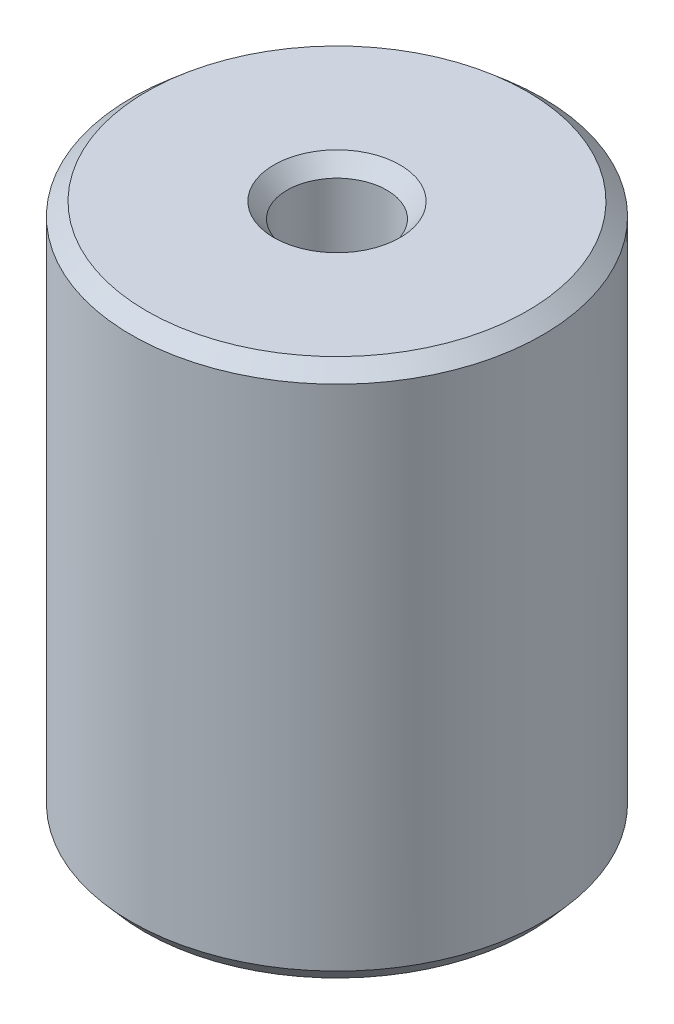
from build123d import *
from OCP.BRepFilletAPI import BRepFilletAPI_MakeChamfer

# Parameters (mm, degrees)
SKETCH1_R           = 5
BOSS_EXTRUDE1_DEPTH = 13.059607712
SKETCH2_R           = 1.214087543
CUT_EXTRUDE1_DEPTH  = 15.851038805
CHAMFER1_SIZE       = 0.320395936
CHAMFER1_SIZE2      = 0.371428901


with BuildPart() as part:
    # Sketch1 → Boss-Extrude1 (new body)
    with BuildSketch(Plane(origin=(0, 0, 0), x_dir=(1, 0, 0), z_dir=(0, 1, 0))):
        Circle(SKETCH1_R)
    extrude(amount=BOSS_EXTRUDE1_DEPTH)

    # Sketch2 → Cut-Extrude1 (cut, through all)
    with BuildSketch(Plane(origin=(0, 0, 0), x_dir=(1, 0, 0), z_dir=(0, 1, 0))):
        Circle(SKETCH2_R)
    extrude(amount=CUT_EXTRUDE1_DEPTH, mode=Mode.SUBTRACT)

    # Chamfer1: one chamfer whose edges measure the first distance from different faces: ONE call of the kernel's chamfer builder (chamfer() names one face for all edges)
    chamfer1_edges_1 = [part.edges().sort_by_distance(p)[0] for p in [
        (-1.214087543, 13.059607712, 0),
    ]]
    chamfer1_side_1 = [part.faces().sort_by_distance(p)[0] for p in [
        (-4.858578644, 13.059607712, 0),
    ]]
    chamfer1_edges_2 = [part.edges().sort_by_distance(p)[0] for p in [
        (-1.214087543, 0, 0),
    ]]
    chamfer1_side_2 = [part.faces().sort_by_distance(p)[0] for p in [
        (-1.214087543, 6.529803856, 0),
    ]]
    chamfer1_edges_3 = [part.edges().sort_by_distance(p)[0] for p in [
        (-5, 0, 0),
    ]]
    chamfer1_side_3 = [part.faces().sort_by_distance(p)[0] for p in [
        (-4.858578644, 0, 0),
    ]]
    chamfer1_edges_4 = [part.edges().sort_by_distance(p)[0] for p in [
        (-5, 13.059607712, 0),
    ]]
    chamfer1_side_4 = [part.faces().sort_by_distance(p)[0] for p in [
        (-5, 6.529803856, 0),
    ]]
    chamfer1 = BRepFilletAPI_MakeChamfer(part.part.solid().wrapped)
    for e in chamfer1_edges_1:
        chamfer1.Add(CHAMFER1_SIZE, CHAMFER1_SIZE2, e.wrapped, chamfer1_side_1[0].wrapped)  # the first distance lies on this face
    for e in chamfer1_edges_2:
        chamfer1.Add(CHAMFER1_SIZE, CHAMFER1_SIZE2, e.wrapped, chamfer1_side_2[0].wrapped)  # the first distance lies on this face
    for e in chamfer1_edges_3:
        chamfer1.Add(CHAMFER1_SIZE, CHAMFER1_SIZE2, e.wrapped, chamfer1_side_3[0].wrapped)  # the first distance lies on this face
    for e in chamfer1_edges_4:
        chamfer1.Add(CHAMFER1_SIZE, CHAMFER1_SIZE2, e.wrapped, chamfer1_side_4[0].wrapped)  # the first distance lies on this face
    add(Compound.cast(chamfer1.Shape()), mode=Mode.REPLACE)


solid = part.part
